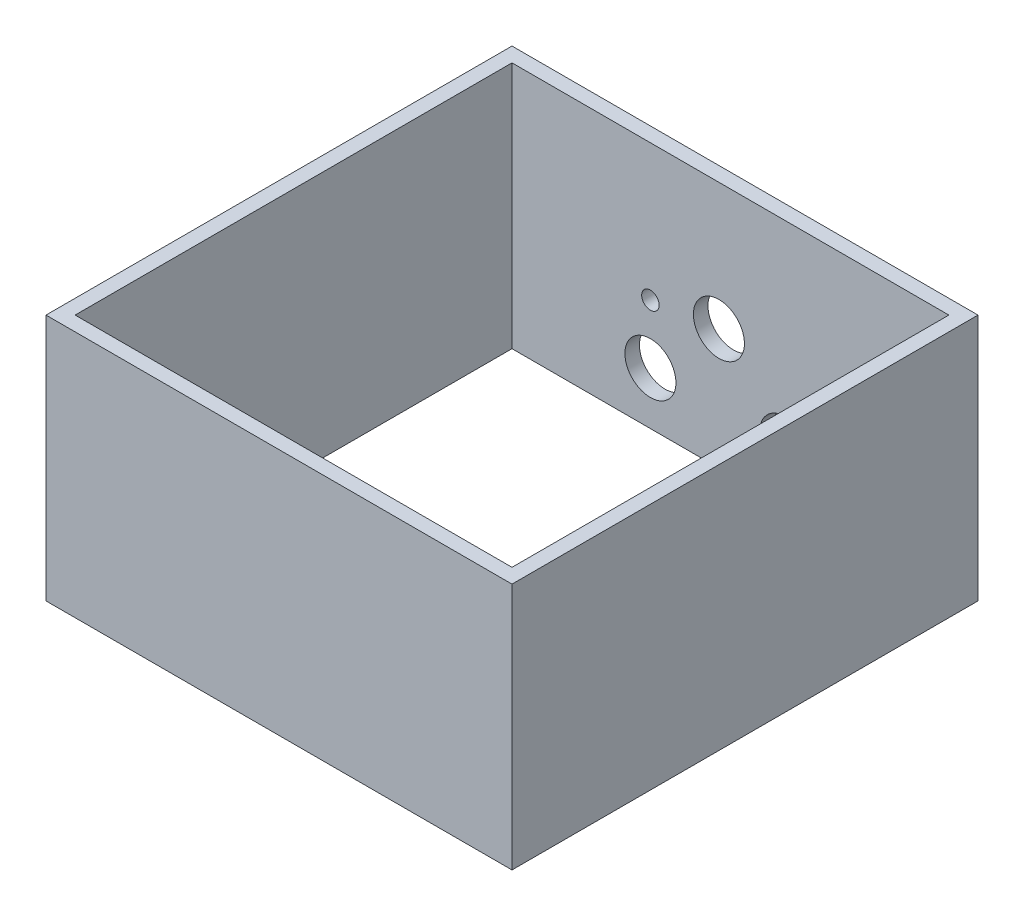
from build123d import *

# Parameters (mm, degrees)
SKETCH1_W                = 101.6
SKETCH1_H                = 101.6
SKETCH1_W_2              = 95.25
SKETCH1_H_2              = 95.25
BOSS_EXTRUDE1_DEPTH      = 53.975
CUT_EXTRUDE2_START       = -50.8
CUT_EXTRUDE2_OUTLINE_R   = 5.5626
CUT_EXTRUDE2_OUTLINE_R_2 = 1.905
CUT_EXTRUDE2_DEPTH       = 3.175


# Read off the part's stored shape, not the designer's step: Cut-Extrude2
with BuildPart() as part:
    # Sketch1 → Boss-Extrude1 (new body)
    with BuildSketch(Plane(origin=(0, 0, 0), x_dir=(1, 0, 0), z_dir=(0, 1, 0))):
        Rectangle(SKETCH1_W, SKETCH1_H)
        Rectangle(SKETCH1_W_2, SKETCH1_H_2, mode=Mode.SUBTRACT)
    extrude(amount=BOSS_EXTRUDE1_DEPTH)

    # Cut-Extrude2 outline → Cut-Extrude2 (cut)
    with BuildSketch(Plane.XY.offset(CUT_EXTRUDE2_START)):
        with Locations((-2.5146, 26.289)):
            Circle(CUT_EXTRUDE2_OUTLINE_R)
        with Locations((23.5204, 24.257)):
            Circle(CUT_EXTRUDE2_OUTLINE_R_2)
        with Locations((11.9634, 11.43)):
            Circle(CUT_EXTRUDE2_OUTLINE_R)
        with Locations((-17.4498, 11.43)):
            Circle(CUT_EXTRUDE2_OUTLINE_R)
        with Locations((-17.4498, 24.257)):
            Circle(CUT_EXTRUDE2_OUTLINE_R_2)
    extrude(amount=CUT_EXTRUDE2_DEPTH, mode=Mode.SUBTRACT)


solid = part.part
